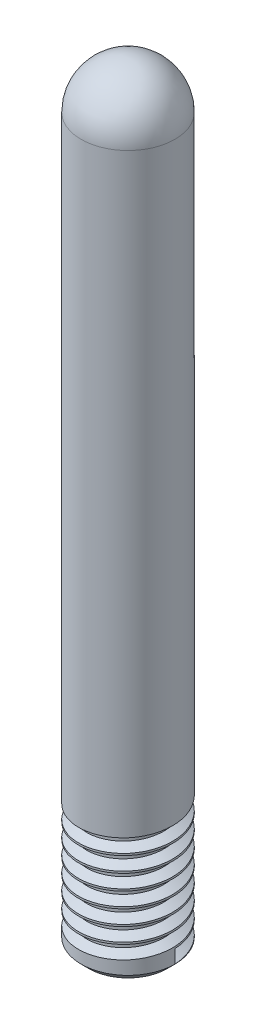
from build123d import *

# Parameters (mm, degrees)
CHAMFUR_BEFORE_THREAD_SIZE = 0.25
THREAD2_PITCH              = 0.5


with BuildPart() as part:
    # Rod Sketch → Rod Revolve (revolve)
    with BuildSketch(Plane.XY):
        with BuildLine():
            Line((0, 0), (1.525, 0))
            Line((1.525, 0), (1.525, 23.475))
            ThreePointArc((1.525, 23.475), (1.078337841, 24.553337841), (0, 25))
            Line((0, 25), (0, 0))
        make_face()
    revolve(axis=Axis((0, 0, 0), (0, 1, 0)))

    # Chamfur Before Thread
    chamfur_before_thread_edges = [part.edges().sort_by_distance(p)[0] for p in [
        (-1.525, 0, 0),
    ]]
    chamfer(chamfur_before_thread_edges, length=CHAMFUR_BEFORE_THREAD_SIZE)

    # Thread2: the profile of Thread Profile2 profile screwed along a right-hand helix of 7.5 turns, 6 arcs to a turn; built about Z, then put on its axis
    thread2_z = Axis((0, 0, 0), (0, 0, 1))
    thread2_corners = [(1.5253, 0, -0.000173205), (1.5253, 0, 0.437673204), (1.254367063, 0, 0.281249999), (1.254367062, 0, 0.156249999)]
    with BuildLine(mode=Mode.PRIVATE) as thread2_profile:
        Line(thread2_corners[0], thread2_corners[1])
        Line(thread2_corners[1], thread2_corners[2])
        Line(thread2_corners[2], thread2_corners[3])
        Line(thread2_corners[3], thread2_corners[0])
    thread2_cap = Face(thread2_profile.wire())
    thread2_turn_angles = [0, 30, 60, 90, 120, 150, 180, 210, 240, 270, 300, 330, 360]
    thread2_turn_weights = [1, 0.8660254037844387, 1, 0.8660254037844387, 1, 0.8660254037844387, 1, 0.8660254037844387, 1, 0.8660254037844387, 1, 0.8660254037844387, 1]
    thread2_turn_rails = [Edge.make_bspline([Vector(p[0], p[1], 0).rotate(thread2_z, thread2_turn_angles[k]) / thread2_turn_weights[k] + Vector(0, 0, p[2] + THREAD2_PITCH * thread2_turn_angles[k] / 360) for k in range(13)], [0, 0, 0, 1, 1, 2, 2, 3, 3, 4, 4, 5, 5, 6, 6, 6], 2, thread2_turn_weights) for p in thread2_corners]
    thread2_turn_sides = [Face.make_surface_from_curves(thread2_turn_rails[p[0]], thread2_turn_rails[p[1]]) for p in [(0, 1), (1, 2), (2, 3), (3, 0)]]
    thread2_last_angles = [2520, 2550, 2580, 2610, 2640, 2670, 2700]
    thread2_last_weights = [1, 0.8660254037844387, 1, 0.8660254037844387, 1, 0.8660254037844426, 1]
    thread2_last_rails = [Edge.make_bspline([Vector(p[0], p[1], 0).rotate(thread2_z, thread2_last_angles[k]) / thread2_last_weights[k] + Vector(0, 0, p[2] + THREAD2_PITCH * thread2_last_angles[k] / 360) for k in range(7)], [0, 0, 0, 1, 1, 2, 2, 3, 3, 3], 2, thread2_last_weights) for p in thread2_corners]
    thread2_last_sides = [Face.make_surface_from_curves(thread2_last_rails[p[0]], thread2_last_rails[p[1]]) for p in [(0, 1), (1, 2), (2, 3), (3, 0)]]
    thread2 = Plane(origin=(0, 0.25, 0), x_dir=(1, 0, 0), z_dir=(0, 1, 0)) * Solid(Shell([*[p.moved(Location((0, 0, THREAD2_PITCH * i))) for i in range(7) for p in thread2_turn_sides], *thread2_last_sides, thread2_cap, thread2_cap.rotate(thread2_z, 2700).moved(Location((0, 0, THREAD2_PITCH * 2700 / 360)))]))
    add(thread2, mode=Mode.SUBTRACT)


solid = part.part
